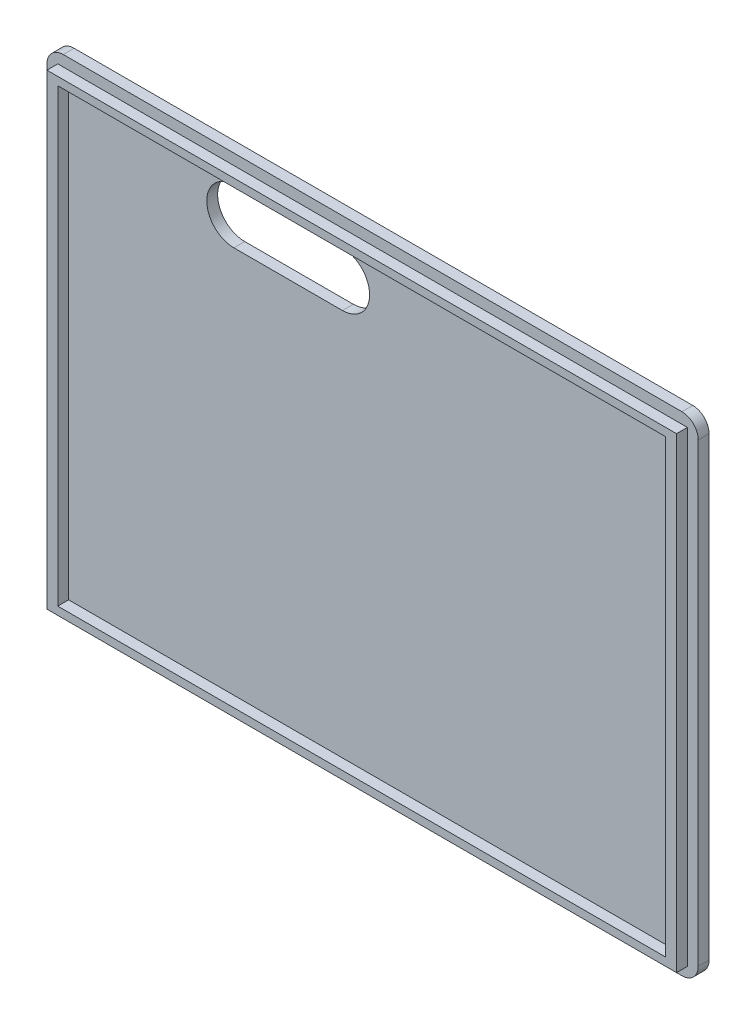
from build123d import *

# Parameters (mm, degrees)
ESQUISSE1_W             = 120
ESQUISSE1_H             = 90
BOSS_EXTRU_1_DEPTH      = 2
ESQUISSE2_W             = 116
ESQUISSE2_H             = 86
ESQUISSE2_W_2           = 112
ESQUISSE2_H_2           = 83.034482758
BOSS_EXTRU_2_DEPTH      = 2
ENL_V_MAT_EXTRU_1_DEPTH = 2
CONG_1_R                = 3


with BuildPart() as part:
    # Esquisse1 → Boss.-Extru.1 (new body)
    with BuildSketch(Plane.XY):
        Rectangle(ESQUISSE1_W, ESQUISSE1_H)
    extrude(amount=BOSS_EXTRU_1_DEPTH)

    # Esquisse2 → Boss.-Extru.2 (add)
    with BuildSketch(Plane.XY.offset(2)):
        Rectangle(ESQUISSE2_W, ESQUISSE2_H)
        Rectangle(ESQUISSE2_W_2, ESQUISSE2_H_2, mode=Mode.SUBTRACT)
    extrude(amount=BOSS_EXTRU_2_DEPTH)

    # Esquisse3 → Enlèv. mat.-Extru.1 (cut)
    with BuildSketch(Plane(origin=(0, 0, 0), x_dir=(-1, 0, 0), z_dir=(0, 0, -1))):
        with BuildLine():
            Line((5.548380707, 39.874958244), (25.548380707, 39.874958244))
            ThreePointArc((25.548380707, 39.874958244), (30.548380707, 34.874958244), (25.548380707, 29.874958244))
            Line((25.548380707, 29.874958244), (5.548380707, 29.874958244))
            ThreePointArc((5.548380707, 29.874958244), (0.548380707, 34.874958244), (5.548380707, 39.874958244))
        make_face()
    extrude(amount=-ENL_V_MAT_EXTRU_1_DEPTH, mode=Mode.SUBTRACT)

    # Congé1
    cong_1_edges = [part.edges().sort_by_distance(p)[0] for p in [
        (60, 45, 1),
        (-60, -45, 1),
        (-60, 45, 1),
        (60, -45, 1),
    ]]
    fillet(cong_1_edges, radius=CONG_1_R)


solid = part.part
